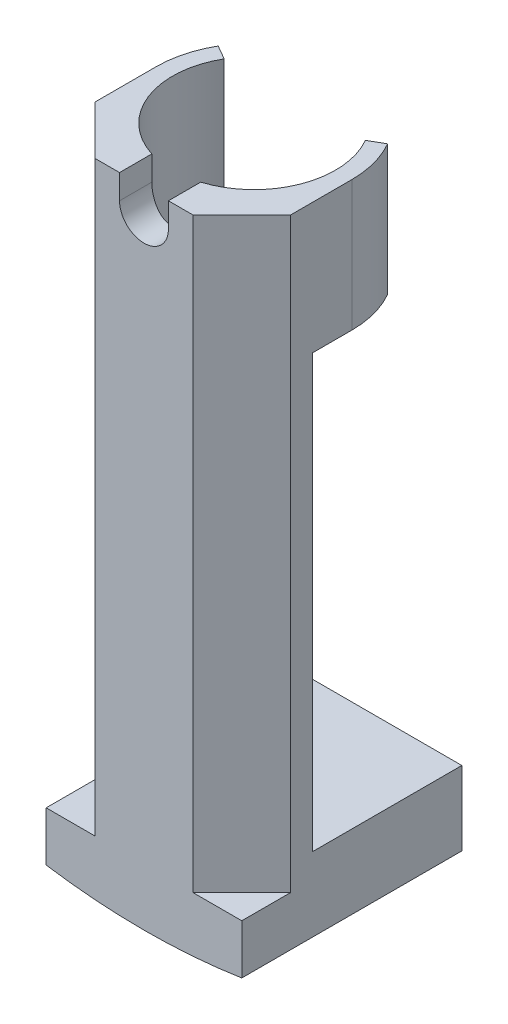
from build123d import *

# Parameters (mm, degrees)
BOSS_EXTRUDE1_DEPTH      = 56
BOSS_EXTRUDE2_DEPTH      = 16
BOSS_EXTRUDE3_DEPTH      = 3
BOSS_EXTRUDE3_DEPTH_BACK = 8
SKETCH4_W                = 24
SKETCH4_H                = 27
SKETCH5_W                = 28.405044576
SKETCH5_H                = 3.736732925
CUT_EXTRUDE2_DEPTH       = 78.826730626
CUT_EXTRUDE3_DEPTH       = 75.231058305


with BuildPart() as part:
    # Sketch2 → Boss-Extrude1 (new body)
    with BuildSketch(Plane(origin=(0, 0, 0), x_dir=(1, 0, 0), z_dir=(0, 1, 0))):
        with BuildLine():
            Line((12, -13.5), (-12, -13.5))
            Line((-12, -13.5), (-12, -4.795831523))
            Line((-12, -4.795831523), (-11, -4.795831523))
            ThreePointArc((-11, -4.795831523), (0, -12), (11, -4.795831523))
            Line((11, -4.795831523), (12, -4.795831523))
            Line((12, -4.795831523), (12, -13.5))
        make_face()
    extrude(amount=BOSS_EXTRUDE1_DEPTH)

    # Sketch3 → Boss-Extrude2 (add)
    with BuildSketch(Plane(origin=(0, 56, 0), x_dir=(1, 0, 0), z_dir=(0, 1, 0))):
        with BuildLine():
            Line((-12, -13.5), (12, -13.5))
            Line((12, -13.5), (12, 0))
            ThreePointArc((12, 0), (11.591109915, 3.105828541), (10.392304845, 6))
            Line((10.392304845, 6), (8.660254038, 5))
            ThreePointArc((8.660254038, 5), (0, -10), (-8.660254038, 5))
            Line((-8.660254038, 5), (-10.392304845, 6))
            ThreePointArc((-10.392304845, 6), (-11.591109915, 3.105828541), (-12, 0))
            Line((-12, 0), (-12, -13.5))
        make_face()
    extrude(amount=BOSS_EXTRUDE2_DEPTH)

    # Sketch4 → Boss-Extrude3 (add, two sides: drawn at the far end of the back side and taken through both)
    with BuildSketch(Plane(origin=(0, 0, 0), x_dir=(1, 0, 0), z_dir=(0, 1, 0)).offset(-BOSS_EXTRUDE3_DEPTH_BACK)):
        Rectangle(SKETCH4_W, SKETCH4_H)
    extrude(amount=BOSS_EXTRUDE3_DEPTH + BOSS_EXTRUDE3_DEPTH_BACK)

    # Sketch5 → Cut-Revolve1 (revolve, cut)
    with BuildSketch(Plane(origin=(0, 0, 0), x_dir=(0, 0, -1), z_dir=(1, 0, 0))):
        with Locations((0.702522288, -8.868366462)):
            Rectangle(SKETCH5_W, SKETCH5_H)
    revolve(axis=Axis((0, 72, 13.5), (0, 0, -1)), mode=Mode.SUBTRACT)

    # Sketch6 → Cut-Extrude2 (cut, through all)
    with BuildSketch(Plane.XY.offset(13.5)):
        with BuildLine():
            Line((-3, 72), (-3, 69))
            ThreePointArc((-3, 69), (0, 66), (3, 69))
            Line((3, 69), (3, 72))
            Line((3, 72), (-3, 72))
        make_face()
    extrude(amount=-CUT_EXTRUDE2_DEPTH, mode=Mode.SUBTRACT)

    # Sketch7 → Cut-Extrude3 (cut, through all)
    with BuildSketch(Plane(origin=(0, 0, 0), x_dir=(1, 0, 0), z_dir=(0, 1, 0))):
        Polygon((6, -13.5), (12, -7.5), (12, -13.5), align=None)
        Polygon((-6, -13.5), (-12, -13.5), (-12, -7.5), align=None)
    extrude(amount=CUT_EXTRUDE3_DEPTH, mode=Mode.SUBTRACT)


solid = part.part
